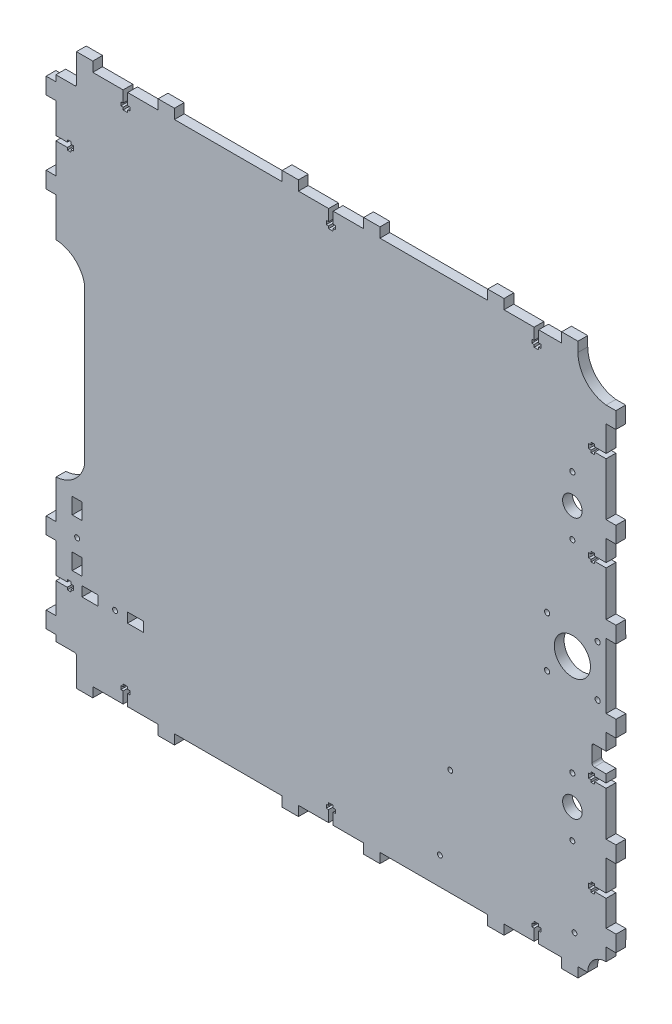
from build123d import *

# Parameters (mm, degrees)
SKETCH_1_R      = 6
SKETCH_1_R_2    = 1.6
SKETCH_1_R_3    = 1.55
SKETCH_1_R_4    = 11.1
SKETCH_1_R_5    = 1.5
SKETCH_1_W      = 9.9
SKETCH_1_H      = 6
SKETCH_1_W_2    = 6
SKETCH_1_H_2    = 9.9
EXTRUDE_1_DEPTH = 6


with BuildPart() as part:
    # Эскиз1 → Бобышка-Вытянуть1 (new body)
    with BuildSketch(Plane.XY):
        with BuildLine():
            Line((168.645123091, -52.430657757), (168.640144484, -57.328883339))
            Line((168.640144484, -57.328883339), (161.640143277, -57.328883339))
            Line((161.640143277, -57.328883339), (161.640143277, -55.928779315))
            Line((161.640143277, -55.928779315), (159.439320695, -55.928779315))
            Line((159.439320695, -55.928779315), (159.440142767, -57.328660279))
            Line((159.440142767, -57.328660279), (157.940143026, -57.329541145))
            Line((157.940143026, -57.329541145), (157.941786771, -60.128623951))
            Line((157.941786771, -60.128623951), (159.441786512, -60.127743085))
            Line((159.441786512, -60.127743085), (159.442609193, -61.52866034))
            Line((159.442609193, -61.52866034), (161.642609604, -61.528713681))
            Line((161.642609604, -61.528713681), (161.642643548, -60.128713681))
            Line((161.642643548, -60.128713681), (168.640144484, -60.129903616))
            Line((168.640144484, -60.129903616), (168.644742949, -87.172853822))
            Line((168.644742949, -87.172853822), (174.644742949, -87.172853822))
            Line((174.644742949, -87.172853822), (174.644299203, -97.172853822))
            Line((174.644299203, -97.172853822), (168.644299203, -97.172853822))
            Line((168.644299203, -97.172853822), (168.644742949, -115.776693192))
            Line((168.644742949, -115.776693192), (161.644741742, -115.776693192))
            Line((161.644741742, -115.776693192), (161.644741742, -114.376589168))
            Line((161.644741742, -114.376589168), (159.443919159, -114.376589168))
            Line((159.443919159, -114.376589168), (159.444741231, -115.776470132))
            Line((159.444741231, -115.776470132), (157.94474149, -115.777350999))
            Line((157.94474149, -115.777350999), (157.946385235, -118.576433805))
            Line((157.946385235, -118.576433805), (159.446384977, -118.575552938))
            Line((159.446384977, -118.575552938), (159.447207657, -119.976470193))
            Line((159.447207657, -119.976470193), (161.647208068, -119.976523534))
            Line((161.647208068, -119.976523534), (161.647242012, -118.576523534))
            Line((161.647242012, -118.576523534), (168.644742949, -118.577713469))
            Line((168.644742949, -118.577713469), (168.645123091, -134.515012031))
            Line((168.645123091, -134.515012031), (174.764313973, -134.515012031))
            Line((174.764313973, -134.515012031), (174.644742949, -144.515012031))
            Line((174.644742949, -144.515012031), (168.645123091, -144.443273963))
            Line((168.645123091, -144.443273963), (168.645123091, -152.246706625))
            ThreePointArc((168.645123091, -152.246706625), (160.666164727, -155.551699393), (157.361171959, -163.530657757))
            Line((157.361171959, -163.530657757), (151.361171959, -163.530657757))
            Line((151.361171959, -163.530657757), (151.377322634, -169.53044609))
            Line((151.377322634, -169.53044609), (141.377322634, -169.53044609))
            Line((141.377322634, -169.53044609), (141.377322634, -163.53044609))
            Line((141.377322634, -163.53044609), (127.271583737, -163.53044609))
            Line((127.271583737, -163.53044609), (127.270393802, -156.532945153))
            Line((127.270393802, -156.532945153), (128.670393801, -156.532911209))
            Line((128.670393801, -156.532911209), (128.670340461, -154.332910799))
            Line((128.670340461, -154.332910799), (127.269423206, -154.332088118))
            Line((127.269423206, -154.332088118), (127.270304072, -152.832088377))
            Line((127.270304072, -152.832088377), (124.471221266, -152.830444631))
            Line((124.471221266, -152.830444631), (124.4703404, -154.330444373))
            Line((124.4703404, -154.330444373), (123.070459435, -154.329622301))
            Line((123.070459435, -154.329622301), (123.070459435, -156.530444883))
            Line((123.070459435, -156.530444883), (124.47056346, -156.530444883))
            Line((124.47056346, -156.530444883), (124.47056346, -163.53044609))
            Line((124.47056346, -163.53044609), (105.993529648, -163.53044609))
            Line((105.993529648, -163.53044609), (105.993529648, -169.53044609))
            Line((105.993529648, -169.53044609), (95.993529648, -169.53044609))
            Line((95.993529648, -169.53044609), (95.993529648, -163.53044609))
            Line((95.993529648, -163.53044609), (29.905510926, -163.53044609))
            Line((29.905510926, -163.53044609), (29.905510926, -169.53044609))
            Line((29.905510926, -169.53044609), (19.905510926, -169.53044609))
            Line((19.905510926, -169.53044609), (19.905510926, -163.53044609))
            Line((19.905510926, -163.53044609), (1.209354796, -163.53044609))
            Line((1.209354796, -163.53044609), (1.208164861, -156.532945153))
            Line((1.208164861, -156.532945153), (2.60816486, -156.532911209))
            Line((2.60816486, -156.532911209), (2.60811152, -154.332910799))
            Line((2.60811152, -154.332910799), (1.207194265, -154.332088118))
            Line((1.207194265, -154.332088118), (1.208075131, -152.832088377))
            Line((1.208075131, -152.832088377), (-1.591007675, -152.830444631))
            Line((-1.591007675, -152.830444631), (-1.591888541, -154.330444373))
            Line((-1.591888541, -154.330444373), (-2.991769506, -154.329622301))
            Line((-2.991769506, -154.329622301), (-2.991769506, -156.530444883))
            Line((-2.991769506, -156.530444883), (-1.591665481, -156.530444883))
            Line((-1.591665481, -156.530444883), (-1.591665481, -163.53044609))
            Line((-1.591665481, -163.53044609), (-20.091480542, -163.53044609))
            Line((-20.091480542, -163.53044609), (-20.091480542, -169.53044609))
            Line((-20.091480542, -169.53044609), (-30.091480542, -169.53044609))
            Line((-30.091480542, -169.53044609), (-30.091480542, -163.53044609))
            Line((-30.091480542, -163.53044609), (-96.177413157, -163.53044609))
            Line((-96.177413157, -163.53044609), (-96.177413157, -169.53044609))
            Line((-96.177413157, -169.53044609), (-106.177413157, -169.53044609))
            Line((-106.177413157, -169.53044609), (-106.177413157, -163.53044609))
            Line((-106.177413157, -163.53044609), (-124.853424337, -163.53044609))
            Line((-124.853424337, -163.53044609), (-124.854614272, -156.532945153))
            Line((-124.854614272, -156.532945153), (-123.454614272, -156.532911209))
            Line((-123.454614272, -156.532911209), (-123.454667612, -154.332910799))
            Line((-123.454667612, -154.332910799), (-124.855584867, -154.332088118))
            Line((-124.855584867, -154.332088118), (-124.854704001, -152.832088377))
            Line((-124.854704001, -152.832088377), (-127.653786807, -152.830444631))
            Line((-127.653786807, -152.830444631), (-127.654667673, -154.330444373))
            Line((-127.654667673, -154.330444373), (-129.054548638, -154.329622301))
            Line((-129.054548638, -154.329622301), (-129.054548638, -156.530444883))
            Line((-129.054548638, -156.530444883), (-127.654444614, -156.530444883))
            Line((-127.654444614, -156.530444883), (-127.654444614, -163.53044609))
            Line((-127.654444614, -163.53044609), (-146.290409327, -163.53044609))
            Line((-146.290409327, -163.53044609), (-146.290409327, -169.53044609))
            Line((-146.290409327, -169.53044609), (-156.290409327, -169.53044609))
            Line((-156.290409327, -169.53044609), (-156.290409327, -151.950531649))
            ThreePointArc((-156.290409327, -151.950531649), (-156.53856952, -151.291185834), (-157.159883135, -150.959086787))
            Line((-157.159883135, -150.959086787), (-157.290409327, -150.950531649))
            Line((-157.290409327, -150.950531649), (-168.896005991, -150.950531649))
            Line((-168.896005991, -150.950531649), (-168.896005991, -147.172604579))
            Line((-168.896005991, -147.172604579), (-174.896005991, -147.172604579))
            Line((-174.896005991, -147.172604579), (-174.896005991, -137.172604579))
            Line((-174.896005991, -137.172604579), (-168.896005991, -137.172604579))
            Line((-168.896005991, -137.172604579), (-168.896005991, -118.574915546))
            Line((-168.896005991, -118.574915546), (-161.896004784, -118.574915546))
            Line((-161.896004784, -118.574915546), (-161.896004784, -119.97501957))
            Line((-161.896004784, -119.97501957), (-159.695182201, -119.97501957))
            Line((-159.695182201, -119.97501957), (-159.696004273, -118.575138606))
            Line((-159.696004273, -118.575138606), (-158.196004532, -118.574257739))
            Line((-158.196004532, -118.574257739), (-158.197648277, -115.775174933))
            Line((-158.197648277, -115.775174933), (-159.697648019, -115.7760558))
            Line((-159.697648019, -115.7760558), (-159.698470699, -114.375138545))
            Line((-159.698470699, -114.375138545), (-161.89847111, -114.375085204))
            Line((-161.89847111, -114.375085204), (-161.898505054, -115.775085204))
            Line((-161.898505054, -115.775085204), (-168.896005991, -115.773895269))
            Line((-168.896005991, -115.773895269), (-168.850719626, -97.172853822))
            Line((-168.850719626, -97.172853822), (-174.896005991, -97.172853822))
            Line((-174.896005991, -97.172853822), (-174.896005991, -87.172853822))
            Line((-174.896005991, -87.172853822), (-168.850719626, -87.172853822))
            Line((-168.850719626, -87.172853822), (-168.850719626, -63.480278176))
            ThreePointArc((-168.850719626, -63.480278176), (-157.437363442, -58.729003262), (-151.290409327, -48.002668015))
            Line((-151.290409327, -48.002668015), (-151.290409327, 47.495869941))
            ThreePointArc((-151.290409327, 47.495869941), (-157.468767593, 58.106186332), (-168.902896389, 62.579621638))
            Line((-168.902896389, 62.579621638), (-168.896005991, 86.494535351))
            Line((-168.896005991, 86.494535351), (-174.896005991, 86.494535351))
            Line((-174.896005991, 86.494535351), (-174.896005991, 96.494535351))
            Line((-174.896005991, 96.494535351), (-168.896005991, 96.494535351))
            Line((-168.896005991, 96.494535351), (-168.896005991, 115.104737517))
            Line((-168.896005991, 115.104737517), (-161.896004784, 115.104737517))
            Line((-161.896004784, 115.104737517), (-161.896004784, 113.704633493))
            Line((-161.896004784, 113.704633493), (-159.695182201, 113.704633493))
            Line((-159.695182201, 113.704633493), (-159.696004273, 115.104514457))
            Line((-159.696004273, 115.104514457), (-158.196004532, 115.105395323))
            Line((-158.196004532, 115.105395323), (-158.197648277, 117.904478129))
            Line((-158.197648277, 117.904478129), (-159.697648019, 117.903597263))
            Line((-159.697648019, 117.903597263), (-159.698470699, 119.304514518))
            Line((-159.698470699, 119.304514518), (-161.89847111, 119.304567859))
            Line((-161.89847111, 119.304567859), (-161.898505054, 117.904567859))
            Line((-161.898505054, 117.904567859), (-168.896005991, 117.905757794))
            Line((-168.896005991, 117.905757794), (-168.896005991, 136.487878691))
            Line((-168.896005991, 136.487878691), (-174.896005991, 136.487878691))
            Line((-174.896005991, 136.487878691), (-174.896005991, 146.487878691))
            Line((-174.896005991, 146.487878691), (-168.896005991, 146.487878691))
            Line((-168.896005991, 146.487878691), (-168.896005991, 150.22196022))
            Line((-168.896005991, 150.22196022), (-157.290409327, 150.22196022))
            ThreePointArc((-157.290409327, 150.22196022), (-156.583302546, 150.514853439), (-156.290409327, 151.22196022))
            Line((-156.290409327, 151.22196022), (-156.290409327, 168.801874662))
            Line((-156.290409327, 168.801874662), (-146.290409327, 168.801874662))
            Line((-146.290409327, 168.801874662), (-146.290409327, 162.801874662))
            Line((-146.290409327, 162.801874662), (-127.654444614, 162.801874662))
            Line((-127.654444614, 162.801874662), (-127.654444614, 155.801873455))
            Line((-127.654444614, 155.801873455), (-129.054548638, 155.801873455))
            Line((-129.054548638, 155.801873455), (-129.054548638, 153.601050872))
            Line((-129.054548638, 153.601050872), (-127.654667673, 153.601872944))
            Line((-127.654667673, 153.601872944), (-127.653786807, 152.101873203))
            Line((-127.653786807, 152.101873203), (-124.854704001, 152.103516948))
            Line((-124.854704001, 152.103516948), (-124.855584867, 153.60351669))
            Line((-124.855584867, 153.60351669), (-123.454667612, 153.60433937))
            Line((-123.454667612, 153.60433937), (-123.454614272, 155.804339781))
            Line((-123.454614272, 155.804339781), (-124.854614272, 155.804373725))
            Line((-124.854614272, 155.804373725), (-124.853424337, 162.801874662))
            Line((-124.853424337, 162.801874662), (-106.177413157, 162.801874662))
            Line((-106.177413157, 162.801874662), (-106.177413157, 168.801874662))
            Line((-106.177413157, 168.801874662), (-96.177413157, 168.801874662))
            Line((-96.177413157, 168.801874662), (-96.177413157, 162.801874662))
            Line((-96.177413157, 162.801874662), (-30.091480542, 162.801874662))
            Line((-30.091480542, 162.801874662), (-30.091480542, 168.801874662))
            Line((-30.091480542, 168.801874662), (-20.091480542, 168.801874662))
            Line((-20.091480542, 168.801874662), (-20.091480542, 162.801874662))
            Line((-20.091480542, 162.801874662), (-1.591665481, 162.801874662))
            Line((-1.591665481, 162.801874662), (-1.591665481, 155.801873455))
            Line((-1.591665481, 155.801873455), (-2.991769506, 155.801873455))
            Line((-2.991769506, 155.801873455), (-2.991769506, 153.601050872))
            Line((-2.991769506, 153.601050872), (-1.591888541, 153.601872944))
            Line((-1.591888541, 153.601872944), (-1.591007675, 152.101873203))
            Line((-1.591007675, 152.101873203), (1.208075131, 152.103516948))
            Line((1.208075131, 152.103516948), (1.207194265, 153.60351669))
            Line((1.207194265, 153.60351669), (2.60811152, 153.60433937))
            Line((2.60811152, 153.60433937), (2.60816486, 155.804339781))
            Line((2.60816486, 155.804339781), (1.208164861, 155.804373725))
            Line((1.208164861, 155.804373725), (1.209354796, 162.801874662))
            Line((1.209354796, 162.801874662), (19.905510926, 162.801874662))
            Line((19.905510926, 162.801874662), (19.905510926, 168.801874662))
            Line((19.905510926, 168.801874662), (29.905510926, 168.801874662))
            Line((29.905510926, 168.801874662), (29.905510926, 162.801874662))
            Line((29.905510926, 162.801874662), (95.993529648, 162.801874662))
            Line((95.993529648, 162.801874662), (95.993529648, 168.801874662))
            Line((95.993529648, 168.801874662), (105.993529648, 168.801874662))
            Line((105.993529648, 168.801874662), (105.993529648, 162.801874662))
            Line((105.993529648, 162.801874662), (124.47056346, 162.801874662))
            Line((124.47056346, 162.801874662), (124.47056346, 155.801873455))
            Line((124.47056346, 155.801873455), (123.070459435, 155.801873455))
            Line((123.070459435, 155.801873455), (123.070459435, 153.601050872))
            Line((123.070459435, 153.601050872), (124.4703404, 153.601872944))
            Line((124.4703404, 153.601872944), (124.471221266, 152.101873203))
            Line((124.471221266, 152.101873203), (127.270304072, 152.103516948))
            Line((127.270304072, 152.103516948), (127.269423206, 153.60351669))
            Line((127.269423206, 153.60351669), (128.670340461, 153.60433937))
            Line((128.670340461, 153.60433937), (128.670393801, 155.804339781))
            Line((128.670393801, 155.804339781), (127.270393802, 155.804373725))
            Line((127.270393802, 155.804373725), (127.271583737, 162.801874662))
            Line((127.271583737, 162.801874662), (141.377322634, 162.801874662))
            Line((141.377322634, 162.801874662), (141.377322634, 168.801874662))
            Line((141.377322634, 168.801874662), (151.377322634, 168.801874662))
            Line((151.377322634, 168.801874662), (151.377322634, 162.801874662))
            ThreePointArc((151.377322634, 162.801874662), (156.285690778, 149.822526904), (168.644742949, 143.51305977))
            Line((168.644742949, 143.51305977), (174.644742949, 143.51305977))
            Line((174.644742949, 143.51305977), (174.644742949, 133.51305977))
            Line((174.644742949, 133.51305977), (168.644742949, 133.51305977))
            Line((168.644742949, 133.51305977), (168.644452814, 117.768035551))
            Line((168.644452814, 117.768035551), (161.644451607, 117.768035551))
            Line((161.644451607, 117.768035551), (161.644451607, 119.168139576))
            Line((161.644451607, 119.168139576), (159.443629024, 119.168139576))
            Line((159.443629024, 119.168139576), (159.444451096, 117.768258611))
            Line((159.444451096, 117.768258611), (157.944451355, 117.767377745))
            Line((157.944451355, 117.767377745), (157.9460951, 114.968294939))
            Line((157.9460951, 114.968294939), (159.446094842, 114.969175805))
            Line((159.446094842, 114.969175805), (159.446917522, 113.56825855))
            Line((159.446917522, 113.56825855), (161.646917933, 113.56820521))
            Line((161.646917933, 113.56820521), (161.646951877, 114.968205209))
            Line((161.646951877, 114.968205209), (168.644452814, 114.967015274))
            Line((168.644452814, 114.967015274), (168.644742949, 82.615216874))
            Line((168.644742949, 82.615216874), (174.644742949, 82.615216874))
            Line((174.644742949, 82.615216874), (174.644742949, 72.615216874))
            Line((174.644742949, 72.615216874), (168.644742949, 72.615216874))
            Line((168.644742949, 72.615216874), (168.644742132, 59.768035552))
            Line((168.644742132, 59.768035552), (161.644740925, 59.768035552))
            Line((161.644740925, 59.768035552), (161.644740925, 61.168139576))
            Line((161.644740925, 61.168139576), (159.443918343, 61.168139576))
            Line((159.443918343, 61.168139576), (159.444740415, 59.768258612))
            Line((159.444740415, 59.768258612), (157.944740674, 59.767377745))
            Line((157.944740674, 59.767377745), (157.946384419, 56.968294939))
            Line((157.946384419, 56.968294939), (159.44638416, 56.969175806))
            Line((159.44638416, 56.969175806), (159.447206841, 55.568258551))
            Line((159.447206841, 55.568258551), (161.647207252, 55.56820521))
            Line((161.647207252, 55.56820521), (161.647241195, 56.96820521))
            Line((161.647241195, 56.96820521), (168.644742132, 56.967015275))
            Line((168.644742132, 56.967015275), (168.644742949, 29.547168442))
            Line((168.644742949, 29.547168442), (174.644742949, 29.547168442))
            Line((174.644742949, 29.547168442), (174.703994009, 19.547168442))
            Line((174.703994009, 19.547168442), (168.644742949, 19.547168442))
            Line((168.644742949, 19.547168442), (168.644742949, -20.3914095))
            Line((168.644742949, -20.3914095), (174.703994009, -20.3914095))
            Line((174.703994009, -20.3914095), (174.703994009, -30.3914095))
            Line((174.703994009, -30.3914095), (168.703994009, -30.3914095))
            Line((168.703994009, -30.3914095), (168.703994009, -40.430657757))
            Line((168.703994009, -40.430657757), (161.403994009, -40.430657757))
            ThreePointArc((161.403994009, -40.430657757), (160.343333837, -40.869997585), (159.903994009, -41.930657757))
            Line((159.903994009, -41.930657757), (159.903994009, -50.930657757))
            ThreePointArc((159.903994009, -50.930657757), (160.343333837, -51.991317929), (161.403994009, -52.430657757))
            Line((161.403994009, -52.430657757), (168.645123091, -52.430657757))
        make_face()
        with Locations((147.949520288, -80.298125338)):
            Circle(SKETCH_1_R, mode=Mode.SUBTRACT)
        with Locations((132.449520287, 15.201874662)):
            Circle(SKETCH_1_R_2, mode=Mode.SUBTRACT)
        with Locations((147.949520287, 61.701874662)):
            Circle(SKETCH_1_R_3, mode=Mode.SUBTRACT)
        with Locations((163.449520287, 15.201874662)):
            Circle(SKETCH_1_R_2, mode=Mode.SUBTRACT)
        with Locations((147.949520288, -62.298125338)):
            Circle(SKETCH_1_R_3, mode=Mode.SUBTRACT)
        with Locations((163.449520287, -15.798125338)):
            Circle(SKETCH_1_R_2, mode=Mode.SUBTRACT)
        with Locations((132.449520287, -15.798125338)):
            Circle(SKETCH_1_R_2, mode=Mode.SUBTRACT)
        with Locations((147.949520287, -0.298125338)):
            Circle(SKETCH_1_R_4, mode=Mode.SUBTRACT)
        with Locations((147.949520287, 97.701874662)):
            Circle(SKETCH_1_R_2, mode=Mode.SUBTRACT)
        with Locations((147.949520287, 79.701874662)):
            Circle(SKETCH_1_R, mode=Mode.SUBTRACT)
        with Locations((-132.646005991, -116.230657757)):
            Circle(SKETCH_1_R_5, mode=Mode.SUBTRACT)
        with Locations((-155.896005991, -89.303657757)):
            Circle(SKETCH_1_R_5, mode=Mode.SUBTRACT)
        with Locations((73.019520288, -98.298125338)):
            Circle(SKETCH_1_R_5, mode=Mode.SUBTRACT)
        with Locations((66.669520288, -146.558125338)):
            Circle(SKETCH_1_R_5, mode=Mode.SUBTRACT)
        with Locations((149.249520288, -146.558125338)):
            Circle(SKETCH_1_R_5, mode=Mode.SUBTRACT)
        with Locations((147.949520288, -98.298125338)):
            Circle(SKETCH_1_R_5, mode=Mode.SUBTRACT)
        with Locations((-120.044005991, -116.230657757)):
            Rectangle(SKETCH_1_W, SKETCH_1_H, mode=Mode.SUBTRACT)
        with Locations((-147.946005991, -116.230657757)):
            Rectangle(SKETCH_1_W, SKETCH_1_H, mode=Mode.SUBTRACT)
        with Locations((-155.896005991, -73.691657757)):
            Rectangle(SKETCH_1_W_2, SKETCH_1_H_2, mode=Mode.SUBTRACT)
        with Locations((-155.896005991, -103.280657757)):
            Rectangle(SKETCH_1_W_2, SKETCH_1_H_2, mode=Mode.SUBTRACT)
    extrude(amount=EXTRUDE_1_DEPTH)


solid = part.part
